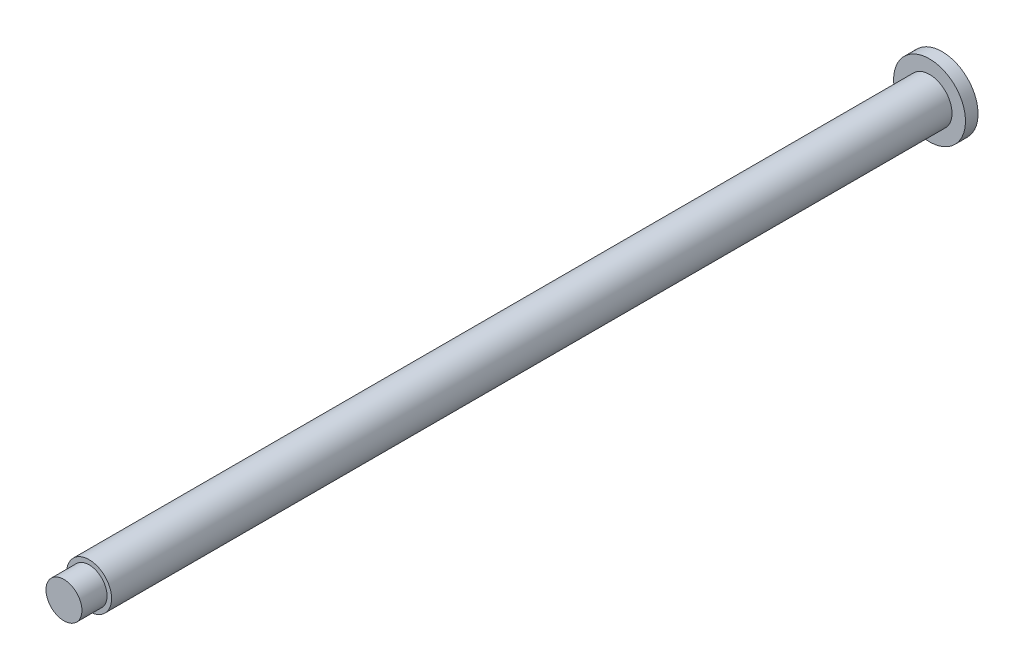
from build123d import *

# Parameters (mm, degrees)
SKETCH1_R           = 2.5
BOSS_EXTRUDE1_DEPTH = 93.5
SKETCH2_R           = 4
BOSS_EXTRUDE2_DEPTH = 1.4
SKETCH3_R           = 2.05
CUT_EXTRUDE1_DEPTH  = 3
SKETCH4_R           = 2
BOSS_EXTRUDE3_DEPTH = 2.8


with BuildPart() as part:
    # Sketch1 → Boss-Extrude1 (new body)
    with BuildSketch(Plane(origin=(0, 0, 0), x_dir=(0, 1, 0), z_dir=(0, 0, 1))):
        Circle(SKETCH1_R)
    extrude(amount=BOSS_EXTRUDE1_DEPTH)

    # Sketch2 → Boss-Extrude2 (add)
    with BuildSketch(Plane(origin=(0, 0, 0), x_dir=(1, 0, 0), z_dir=(0, 0, -1))):
        Circle(SKETCH2_R)
    extrude(amount=BOSS_EXTRUDE2_DEPTH)

    # Sketch3 → Cut-Extrude1 (cut)
    with BuildSketch(Plane(origin=(0, 0, -1.4), x_dir=(1, 0, 0), z_dir=(0, 0, -1))):
        Circle(SKETCH3_R)
    extrude(amount=-CUT_EXTRUDE1_DEPTH, mode=Mode.SUBTRACT)

    # Sketch4 → Boss-Extrude3 (add)
    with BuildSketch(Plane.XY.offset(93.5)):
        Circle(SKETCH4_R)
    extrude(amount=BOSS_EXTRUDE3_DEPTH)


solid = part.part
